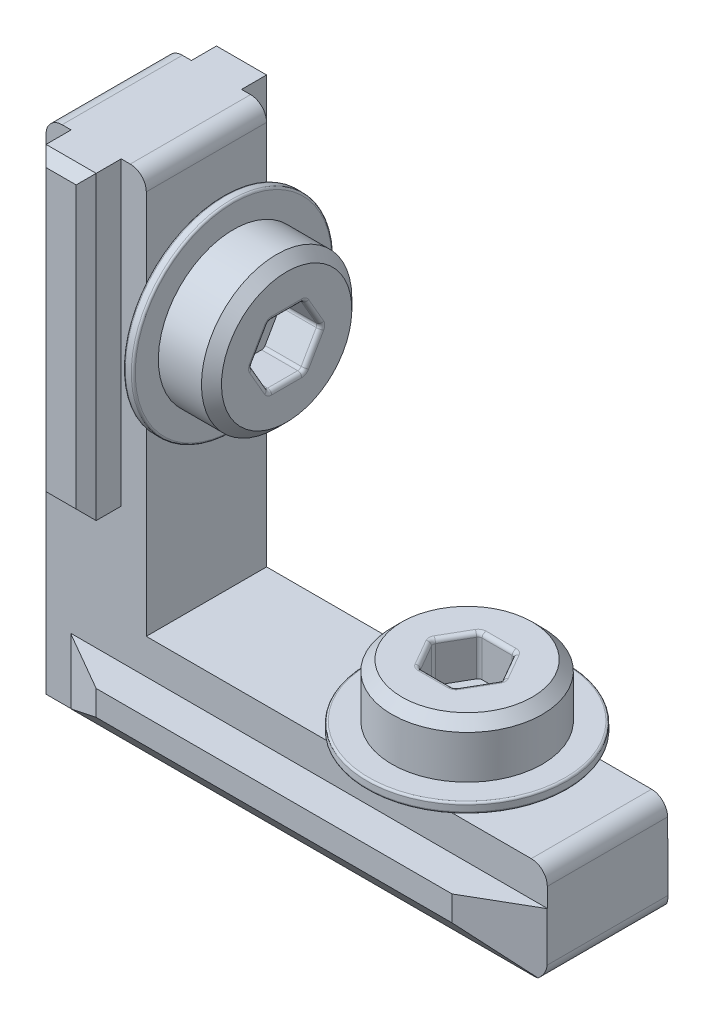
from build123d import *

# Parameters (mm, degrees)
EXTRUDE1_DEPTH      = 3
EXTRUDE1_DEPTH_BACK = 3
SKETCH2_W           = 2.5
SKETCH2_H           = 15
SKETCH2_W_2         = 23.75
SKETCH2_H_2         = 3.25
EXTRUDE2_DEPTH      = 1.75
CHAMFER1_SIZE       = 3
CHAMFER1_SIZE2      = 1.732050808
CHAMFER2_SIZE       = 2
CHAMFER2_SIZE2      = 1.738573476
CHAMFER3_SIZE       = 0.5
EXTRUDE3_REACH      = 30.68
SKETCH4_R           = 2
FILLET1_R           = 0.8
SKETCH5_R           = 3.75
BOSS_EXTRUDE1_DEPTH = 4
CHAMFER4_SIZE       = 0.5
CUT_EXTRUDE1_DEPTH  = 2
FILLET2_R           = 0.2
SKETCH7_R           = 3.75
BOSS_EXTRUDE2_DEPTH = 4
CHAMFER5_SIZE       = 0.5
CUT_EXTRUDE2_DEPTH  = 2
FILLET3_R           = 0.2
CUT_EXTRUDE3_START  = 0.85
SKETCH9_R           = 4.868453385
SKETCH9_R_2         = 2
CUT_EXTRUDE3_DEPTH  = 0.85
SKETCH10_R          = 4.694826999
SKETCH10_R_2        = 2.05
CUT_EXTRUDE8_DEPTH  = 0.85
CHAMFER6_SIZE       = 0.2
CHAMFER7_SIZE       = 0.2
SKETCH12_R          = 5
BOSS_EXTRUDE3_DEPTH = 0.5
SKETCH13_R          = 5
BOSS_EXTRUDE4_DEPTH = 0.5
FILLET4_R           = 0.1
FILLET5_R           = 0.1


# Read off the part's stored shape, not the designer's step: Mirror1
with BuildPart() as part:
    # Sketch1 → Extrude1 (new, two sides: drawn at the far end of the back side and taken through both)
    with BuildSketch(Plane.XY.offset(-EXTRUDE1_DEPTH_BACK)):
        Polygon((0, 0), (0, 20), (-5, 20), (-5, -5), (20, -5), (20, 0), align=None)
    extrude(amount=EXTRUDE1_DEPTH + EXTRUDE1_DEPTH_BACK)

    # Sketch2 → Extrude2 (add)
    with BuildSketch(Plane.XY.offset(3)):
        with Locations((-2.5, 12.5)):
            Rectangle(SKETCH2_W, SKETCH2_H)
        with Locations((8.125, -3.375)):
            Rectangle(SKETCH2_W_2, SKETCH2_H_2)
    extrude(amount=EXTRUDE2_DEPTH)

    # Chamfer1
    chamfer1_edges = [part.edges().sort_by_distance(p)[0] for p in [
        (20, -3.375, 4.75),
        (-3.75, -3.375, 4.75),
    ]]
    chamfer1_side = [part.faces().sort_by_distance(p)[0] for p in [
        (8.125, -3.375, 4.75),
    ]]
    chamfer(chamfer1_edges, length=CHAMFER1_SIZE, length2=CHAMFER1_SIZE2, reference=chamfer1_side[0])

    # Chamfer2
    chamfer2_edges = [part.edges().sort_by_distance(p)[0] for p in [
        (8.125, -5, 4.75),
    ]]
    chamfer2_side = [part.faces().sort_by_distance(p)[0] for p in [
        (8.125, -3.375, 4.75),
    ]]
    chamfer(chamfer2_edges, length=CHAMFER2_SIZE, length2=CHAMFER2_SIZE2, reference=chamfer2_side[0])

    # Chamfer3
    chamfer3_edges = [part.edges().sort_by_distance(p)[0] for p in [
        (-2.5, 20, 4.75),
        (-1.25, 12.5, 4.75),
        (-2.5, 5, 4.75),
        (-3.75, 12.5, 4.75),
    ]]
    chamfer(chamfer3_edges, length=CHAMFER3_SIZE)

    # Mirror1: part across plane


with BuildPart() as part_1:
    add(part.part)
    add(part.part.mirror(Plane.XY))

    # Sketch4 → Extrude3 (cut, up to next)
    with BuildSketch(Plane(origin=(0, 0, 0), x_dir=(1, 0, 0), z_dir=(0, 1, 0)), mode=Mode.PRIVATE) as extrude3_sk1:
        with Locations(Location((13, 0, 0), (0, 0, 270))):
            Circle(SKETCH4_R)
    extrude3_tool1 = extrude(extrude3_sk1.sketch, amount=-EXTRUDE3_REACH, mode=Mode.PRIVATE) & part_1.part
    extrude3 = extrude3_tool1.solids().sort_by_distance((13, 0, 0))[0]
    add(extrude3, mode=Mode.SUBTRACT)

    # Mirror2: Extrude3 across plane
    add(extrude3.mirror(Plane(origin=(0, 0, 0), x_dir=(0, 0, 1), z_dir=(0.7071067811865476, -0.7071067811865475, 0))), mode=Mode.SUBTRACT)

    # Fillet1
    fillet1_edges = [part_1.edges().sort_by_distance(p)[0] for p in [
        (-5, 20, 0),
        (20, -5, 0),
        (20, 0, 0),
        (0, 20, 0),
    ]]
    fillet(fillet1_edges, radius=FILLET1_R)

    # Sketch5 → Boss-Extrude1 (add)
    with BuildSketch(Plane(origin=(0, 0, 0), x_dir=(1, 0, 0), z_dir=(0, 1, 0))):
        with Locations(Location((13, 0, 0), (0, 0, 306.869897646))):
            Circle(SKETCH5_R)
    extrude(amount=BOSS_EXTRUDE1_DEPTH)

    # Chamfer4
    chamfer4_edges = [part_1.edges().sort_by_distance(p)[0] for p in [
        (10.75, 4, -3),
    ]]
    chamfer(chamfer4_edges, length=CHAMFER4_SIZE)

    # Sketch6 → Cut-Extrude1 (cut)
    with BuildSketch(Plane(origin=(0, 4, 0), x_dir=(1, 0, 0), z_dir=(0, 1, 0))):
        Polygon((14.732050808, 0), (13.866025404, 1.5), (12.133974596, 1.5), (11.267949192, 0), (12.133974596, -1.5), (13.866025404, -1.5), align=None)
    extrude(amount=-CUT_EXTRUDE1_DEPTH, mode=Mode.SUBTRACT)

    # Fillet2
    fillet2_edges = [part_1.edges().sort_by_distance(p)[0] for p in [
        (14.732050808, 3, 0),
        (13.866025404, 3, 1.5),
        (12.133974596, 3, 1.5),
        (11.267949192, 3, 0),
        (12.133974596, 3, -1.5),
        (13.866025404, 3, -1.5),
        (14.299038106, 4, 0.75),
        (14.299038106, 4, -0.75),
        (13, 4, -1.5),
        (11.700961894, 4, -0.75),
        (11.700961894, 4, 0.75),
        (13, 4, 1.5),
    ]]
    fillet(fillet2_edges, radius=FILLET2_R)

    # Sketch7 → Boss-Extrude2 (add)
    with BuildSketch(Plane(origin=(0, 0, 0), x_dir=(0, 0, -1), z_dir=(1, 0, 0))):
        with Locations(Location((0, 13, 0), (0, 0, 216.869897646))):
            Circle(SKETCH7_R)
    extrude(amount=BOSS_EXTRUDE2_DEPTH)

    # Chamfer5
    chamfer5_edges = [part_1.edges().sort_by_distance(p)[0] for p in [
        (4, 15.25, -3),
    ]]
    chamfer(chamfer5_edges, length=CHAMFER5_SIZE)

    # Sketch8 → Cut-Extrude2 (cut)
    with BuildSketch(Plane(origin=(4, 0, 0), x_dir=(0, 0, -1), z_dir=(1, 0, 0))):
        Polygon((1.732050808, 13), (0.866025404, 14.5), (-0.866025404, 14.5), (-1.732050808, 13), (-0.866025404, 11.5), (0.866025404, 11.5), align=None)
    extrude(amount=-CUT_EXTRUDE2_DEPTH, mode=Mode.SUBTRACT)

    # Fillet3
    fillet3_edges = [part_1.edges().sort_by_distance(p)[0] for p in [
        (3, 13, -1.732050808),
        (3, 11.5, -0.866025404),
        (3, 11.5, 0.866025404),
        (3, 13, 1.732050808),
        (3, 14.5, 0.866025404),
        (3, 14.5, -0.866025404),
        (4, 12.25, -1.299038106),
        (4, 13.75, -1.299038106),
        (4, 14.5, 0),
        (4, 13.75, 1.299038106),
        (4, 12.25, 1.299038106),
        (4, 11.5, 0),
    ]]
    fillet(fillet3_edges, radius=FILLET3_R)

    # Sketch9 → Cut-Extrude3 (cut)
    with BuildSketch(Plane(origin=(0, 0, 0), x_dir=(1, 0, 0), z_dir=(0, 1, 0)).offset(CUT_EXTRUDE3_START)):
        with Locations((13, 0)):
            Circle(SKETCH9_R)
        with Locations((13, 0)):
            Circle(SKETCH9_R_2, mode=Mode.SUBTRACT)
    extrude(amount=-CUT_EXTRUDE3_DEPTH, mode=Mode.SUBTRACT)


with BuildPart() as cut_extrude3_piece_1:
    # of the separate pieces the step leaves, piece 1, a body of its own (cut_extrude3_pieces)
    add(part_1.part.solids().sort_by_distance((4, 11.5, -1.096965511))[0])

    # Sketch10 → Cut-Extrude8 (cut)
    with BuildSketch(Plane(origin=(0, 0, 0), x_dir=(0, 0, -1), z_dir=(1, 0, 0))):
        with Locations((0, 13)):
            Circle(SKETCH10_R)
        with Locations(Location((0, 13, 0), (0, 0, 90))):
            Circle(SKETCH10_R_2, mode=Mode.SUBTRACT)
    extrude(amount=CUT_EXTRUDE8_DEPTH, mode=Mode.SUBTRACT)

    # Chamfer6
    chamfer6_edges = [cut_extrude3_piece_1.edges().sort_by_distance(p)[0] for p in [
        (0.85, 15.25, -3),
    ]]
    chamfer(chamfer6_edges, length=CHAMFER6_SIZE)

    # Sketch12 → Boss-Extrude3 (add)
    with BuildSketch(Plane.ZY.offset(-0.85)):
        with Locations(Location((0, 13, 0), (0, 0, 270))):
            Circle(SKETCH12_R)
    extrude(amount=-BOSS_EXTRUDE3_DEPTH)

    # Fillet5
    fillet5_edges = [cut_extrude3_piece_1.edges().sort_by_distance(p)[0] for p in [
        (1.35, 18, 0),
        (0.85, 18, 0),
    ]]
    fillet(fillet5_edges, radius=FILLET5_R)


with BuildPart() as cut_extrude3_piece_2:
    # of the separate pieces the step leaves, piece 2, a body of its own (cut_extrude3_pieces)
    add(part_1.part.solids().sort_by_distance((15, 0.85, 0))[0])

    # Chamfer7
    chamfer7_edges = [cut_extrude3_piece_2.edges().sort_by_distance(p)[0] for p in [
        (10.75, 0.85, -3),
    ]]
    chamfer(chamfer7_edges, length=CHAMFER7_SIZE)

    # Sketch13 → Boss-Extrude4 (add)
    with BuildSketch(Plane.XZ.offset(-0.85)):
        with Locations((13, 0)):
            Circle(SKETCH13_R)
    extrude(amount=-BOSS_EXTRUDE4_DEPTH)

    # Fillet4
    fillet4_edges = [cut_extrude3_piece_2.edges().sort_by_distance(p)[0] for p in [
        (8, 1.35, 0),
        (8, 0.85, 0),
    ]]
    fillet(fillet4_edges, radius=FILLET4_R)


solid = Compound([cut_extrude3_piece_1.part, cut_extrude3_piece_2.part])
